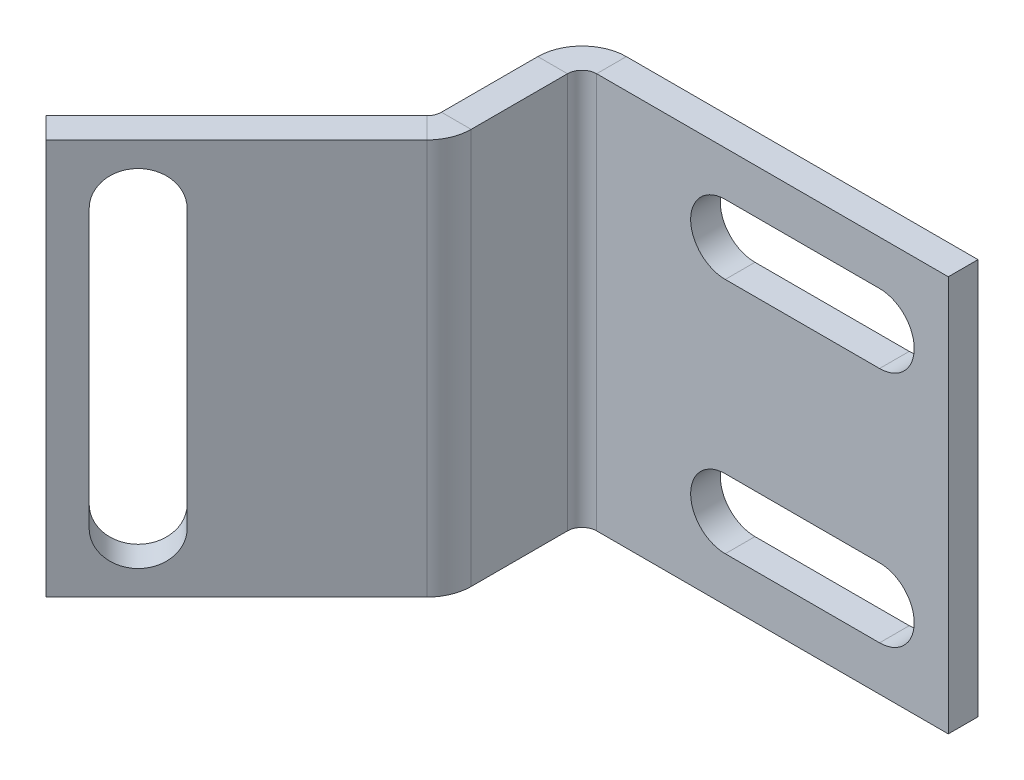
from build123d import *

# Parameters (mm, degrees)
SKETCH1_W                    = 20
SKETCH1_H                    = 20
BASE_FLANGE1_DEPTH           = 1.5
EDGE_FLANGE1_STRIP_W         = 7.4732
EDGE_FLANGE1_STRIP_H         = 1.5
EDGE_FLANGE1_STRIP_CUT_DEPTH = 20
EDGE_FLANGE1_DEPTH           = 20
EDGE_FLANGE2_START           = -16.736526946
EDGE_FLANGE2_DEPTH           = 20
EDGE_FLANGE2_2_DEPTH         = 20
CUT_EXTRUDE1_DEPTH           = 30.323545381
CUT_EXTRUDE2_DEPTH           = 10


# Read off the part's stored shape, not the designer's step: Edge-Flange2
# Sheet-metal steps are written as plain solids
with BuildPart() as part:
    # Sketch1 → Base-Flange1 (new body)
    with BuildSketch(Plane.XY):
        with Locations((4.191616766, -6.736526946)):
            Rectangle(SKETCH1_W, SKETCH1_H)
    extrude(amount=-BASE_FLANGE1_DEPTH)

    # Edge-Flange1 strip (across the edge) → Edge-Flange1 strip cut (cut)
    with BuildSketch(Plane(origin=(-5.808383234, 3.263473054, 0), x_dir=(1, 0, 0), z_dir=(0, -1, 0))):
        with Locations((-1.5, -0.75)):
            Rectangle(EDGE_FLANGE1_STRIP_W, EDGE_FLANGE1_STRIP_H)
    extrude(amount=EDGE_FLANGE1_STRIP_CUT_DEPTH, mode=Mode.SUBTRACT)

    # Edge-Flange1 section (across the edge) → Edge-Flange1 (add)
    with BuildSketch(Plane(origin=(-5.808383234, 3.263473054, 0), x_dir=(1, 0, 0), z_dir=(0, -1, 0))):
        with BuildLine():
            Line((0, 0.7366), (0, 8.03))
            Line((0, 8.03), (1.5, 8.03))
            Line((1.5, 8.03), (1.5, 0.7366))
            ThreePointArc((1.5, 0.7366), (1.715745145, 0.215745145), (2.2366, 0))
            Line((2.2366, 0), (2.2366, -1.5))
            ThreePointArc((2.2366, -1.5), (0.655084973, -0.844915027), (0, 0.7366))
        make_face()
    extrude(amount=EDGE_FLANGE1_DEPTH)

    # Edge-Flange2 outline → Edge-Flange2 (cut)
    with BuildSketch(Plane(origin=(0, 0, 0), x_dir=(1, 0, 0), z_dir=(0, 1, 0)).offset(EDGE_FLANGE2_START)):
        with BuildLine():
            ThreePointArc((-4.308383234, -5.603569946), (-4.478634271, -6.459479711), (-4.963468207, -7.185084973))
            Line((-4.963468207, -7.185084973), (-5.808383234, -8.03))
            Line((-5.808383234, -8.03), (-4.308383234, -8.03))
            Line((-4.308383234, -8.03), (-4.308383234, -5.603569946))
        make_face()
    extrude(amount=EDGE_FLANGE2_DEPTH, mode=Mode.SUBTRACT)

    # Edge-Flange2 2 outline → Edge-Flange2 2 (add)
    with BuildSketch(Plane(origin=(0, 0, 0), x_dir=(1, 0, 0), z_dir=(0, 1, 0)).offset(EDGE_FLANGE2_START)):
        with BuildLine():
            Line((-14.582644764, -16.804261531), (-5.808383234, -8.03))
            Line((-5.808383234, -8.03), (-5.808383234, -5.603569946))
            ThreePointArc((-5.808383234, -5.603569946), (-5.86445357, -5.885454563), (-6.024128379, -6.124424801))
            Line((-6.024128379, -6.124424801), (-15.643304936, -15.743601359))
            Line((-15.643304936, -15.743601359), (-14.582644764, -16.804261531))
        make_face()
    extrude(amount=EDGE_FLANGE2_2_DEPTH)

    # Sketch12 → Cut-Extrude1 (cut, through all)
    with BuildSketch(Plane(origin=(0, 0, -1.5), x_dir=(-1, 0, 0), z_dir=(0, 0, -1))):
        with BuildLine():
            Line((-2.925555282, -14.486526946), (-10.71929847, -14.486526946))
            ThreePointArc((-10.71929847, -14.486526946), (-12.46929847, -12.736526946), (-10.71929847, -10.986526946))
            Line((-10.71929847, -10.986526946), (-2.925555282, -10.986526946))
            ThreePointArc((-2.925555282, -10.986526946), (-1.175555282, -12.736526946), (-2.925555282, -14.486526946))
        make_face()
        with BuildLine():
            Line((-2.925555282, -2.486526946), (-10.71929847, -2.486526946))
            ThreePointArc((-10.71929847, -2.486526946), (-12.46929847, -0.736526946), (-10.71929847, 1.013473054))
            Line((-10.71929847, 1.013473054), (-2.925555282, 1.013473054))
            ThreePointArc((-2.925555282, 1.013473054), (-1.175555282, -0.736526946), (-2.925555282, -2.486526946))
        make_face()
    extrude(amount=-CUT_EXTRUDE1_DEPTH, mode=Mode.SUBTRACT)

    # Sketch13 → Cut-Extrude2 (cut)
    with BuildSketch(Plane(origin=(0.050148211, 0, 0.050148211), x_dir=(-0.7071067811865465, 0, 0.7071067811865487), z_dir=(-0.7071067811865487, 0, -0.7071067811865465))):
        with BuildLine():
            Line((17.152424018, -13.736526946), (17.152424018, 0.263473054))
            ThreePointArc((17.152424018, 0.263473054), (18.902424018, 2.013473054), (20.652424018, 0.263473054))
            Line((20.652424018, 0.263473054), (20.652424018, -13.736526946))
            ThreePointArc((20.652424018, -13.736526946), (18.902424018, -15.486526946), (17.152424018, -13.736526946))
        make_face()
    extrude(amount=-CUT_EXTRUDE2_DEPTH, mode=Mode.SUBTRACT)


solid = part.part
